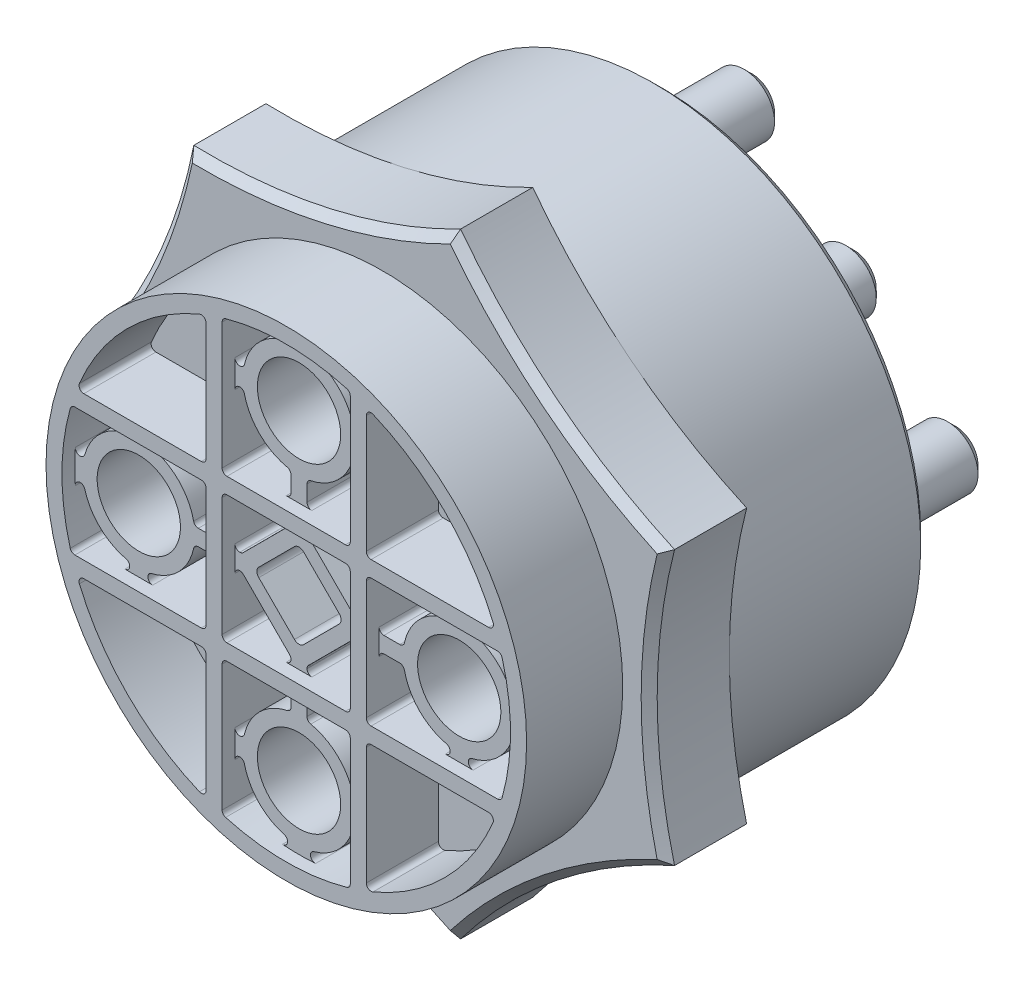
from build123d import *

# Parameters (mm, degrees)
SKETCH1_R                = 16.65
SKETCH1_R_2              = 3.275
SKETCH1_R_3              = 4.1
BOSS_EXTRUDE1_DEPTH      = 2.375
SKETCH2_R                = 16.65
BOSS_EXTRUDE2_DEPTH      = 22.075
CUT_EXTRUDE1_START       = -10
SKETCH3_R                = 16.65
SKETCH3_R_2              = 15
CUT_EXTRUDE1_DEPTH       = 10
CUT_EXTRUDE3_DEPTH       = 4.5
SKETCH6_3_R              = 2.5
CUT_EXTRUDE4_DEPTH       = 0.8
SKETCH6_4_R              = 2.5
CUT_EXTRUDE5_DEPTH       = 9.2
CUT_EXTRUDE6_DEPTH       = 29.053653951
SKETCH8_R                = 3.5
CUT_EXTRUDE7_DEPTH       = 2.8
BOSS_EXTRUDE3_DEPTH      = 4
BOSS_EXTRUDE3_DEPTH_BACK = 2
SKETCH9_R                = 15
SKETCH10_R               = 1.9
BOSS_EXTRUDE4_DEPTH      = 8
CHAMFER1_SIZE            = 0.5
CHAMFER2_SIZE            = 0.5
SKETCH11_R               = 2.5
BOSS_EXTRUDE5_DEPTH      = 0.3
SKETCH12_R               = 2.6
CUT_EXTRUDE8_DEPTH       = 8.1
CUT_EXTRUDE9_DEPTH       = 41.158350746
CUT_EXTRUDE10_DEPTH      = 1
SKETCH15_R               = 3.5
CUT_EXTRUDE11_DEPTH      = 0.1


with BuildPart() as part:
    # Sketch1 → Boss-Extrude1 (new body)
    with BuildSketch(Plane.XY):
        with Locations(Location((0, 0, 0), (0, 0, 180))):
            Circle(SKETCH1_R)
        with Locations(Location((-6.35, 6.35, 0), (0, 0, 180))):
            Circle(SKETCH1_R_2, mode=Mode.SUBTRACT)
        with Locations(Location((-12.7, 0, 0), (0, 0, 180))):
            Circle(SKETCH1_R_2, mode=Mode.SUBTRACT)
        with Locations(Location((-6.35, -6.35, 0), (0, 0, 180))):
            Circle(SKETCH1_R_2, mode=Mode.SUBTRACT)
        with Locations(Location((0, 0, 0), (0, 0, 180))):
            Circle(SKETCH1_R_3, mode=Mode.SUBTRACT)
        with Locations(Location((0, 12.7, 0), (0, 0, 180))):
            Circle(SKETCH1_R_2, mode=Mode.SUBTRACT)
        with Locations(Location((6.35, 6.35, 0), (0, 0, 180))):
            Circle(SKETCH1_R_2, mode=Mode.SUBTRACT)
        with Locations(Location((12.7, 0, 0), (0, 0, 180))):
            Circle(SKETCH1_R_2, mode=Mode.SUBTRACT)
        with Locations(Location((6.35, -6.35, 0), (0, 0, 180))):
            Circle(SKETCH1_R_2, mode=Mode.SUBTRACT)
        with Locations(Location((0, -12.7, 0), (0, 0, 180))):
            Circle(SKETCH1_R_2, mode=Mode.SUBTRACT)
    extrude(amount=BOSS_EXTRUDE1_DEPTH)

    # Sketch2 → Boss-Extrude2 (add)
    with BuildSketch(Plane.XY.offset(2.375)):
        with Locations(Location((0, 0, 0), (0, 0, 180))):
            Circle(SKETCH2_R)
    extrude(amount=BOSS_EXTRUDE2_DEPTH)

    # Sketch3 → Cut-Extrude1 (cut)
    with BuildSketch(Plane.XY.offset(24.45).offset(CUT_EXTRUDE1_START)):
        with Locations(Location((0, 0, 0), (0, 0, 180))):
            Circle(SKETCH3_R)
        Circle(SKETCH3_R_2, mode=Mode.SUBTRACT)
    extrude(amount=CUT_EXTRUDE1_DEPTH, mode=Mode.SUBTRACT)

    # Sketch6 → Cut-Extrude3 (cut)
    with BuildSketch(Plane.XY.offset(24.45)):
        with BuildLine():
            Line((-12.640008247, 5.029016647), (-5.306718889, 5.029016647))
            ThreePointArc((-5.306718889, 5.029016647), (-5.094586855, 5.116884613), (-5.006718889, 5.329016647))
            Line((-5.006718889, 5.329016647), (-5.006718889, 12.662306005))
            ThreePointArc((-5.006718889, 12.662306005), (-5.140612776, 12.912123457), (-5.422777283, 12.938947378))
            ThreePointArc((-5.422777283, 12.938947378), (-9.906213826, 9.928511584), (-12.91664962, 5.445075041))
            ThreePointArc((-12.91664962, 5.445075041), (-12.889825699, 5.162910534), (-12.640008247, 5.029016647))
        make_face()
        with BuildLine():
            ThreePointArc((-5.006718889, 3.729016647), (-5.094586855, 3.941148681), (-5.306718889, 4.029016647))
            Line((-5.306718889, 4.029016647), (-9.140693485, 4.029016647))
            ThreePointArc((-9.140693485, 4.029016647), (-9.438713266, 3.763429007), (-9.209063912, 3.436911384))
            ThreePointArc((-9.209063912, 3.436911384), (-7.509906625, 2.481755629), (-6.585160222, 0.765858752))
            ThreePointArc((-6.585160222, 0.765858752), (-6.480368024, 0.595620665), (-6.291883765, 0.529016647))
            Line((-6.291883765, 0.529016647), (-5.306718889, 0.529016647))
            ThreePointArc((-5.306718889, 0.529016647), (-5.094586855, 0.616884613), (-5.006718889, 0.829016647))
            Line((-5.006718889, 0.829016647), (-5.006718889, 3.729016647))
        make_face()
        with BuildLine():
            ThreePointArc((-10.804373866, 3.436911384), (-10.574724512, 3.763429007), (-10.872744293, 4.029016647))
            Line((-10.872744293, 4.029016647), (-13.197624847, 4.029016647))
            ThreePointArc((-13.197624847, 4.029016647), (-13.378861475, 3.968084179), (-13.486476803, 3.810038545))
            ThreePointArc((-13.486476803, 3.810038545), (-13.795956479, 2.449125466), (-13.968397721, 1.064161173))
            ThreePointArc((-13.968397721, 1.064161173), (-13.720540912, 0.746402019), (-13.380074152, 0.962008752))
            ThreePointArc((-13.380074152, 0.962008752), (-12.431717315, 2.552780232), (-10.804373866, 3.436911384))
        make_face()
        with BuildLine():
            ThreePointArc((-13.380074152, -0.903975458), (-13.720540912, -0.688368725), (-13.968397721, -1.006127879))
            ThreePointArc((-13.968397721, -1.006127879), (-13.795956479, -2.391092172), (-13.486476803, -3.752005251))
            ThreePointArc((-13.486476803, -3.752005251), (-13.378861475, -3.910050885), (-13.197624847, -3.970983353))
            Line((-13.197624847, -3.970983353), (-10.872744293, -3.970983353))
            ThreePointArc((-10.872744293, -3.970983353), (-10.574724512, -3.705395713), (-10.804373866, -3.37887809))
            ThreePointArc((-10.804373866, -3.37887809), (-12.431717315, -2.494746938), (-13.380074152, -0.903975458))
        make_face()
        with BuildLine():
            Line((-5.006718889, -3.670983353), (-5.006718889, -0.770983353))
            ThreePointArc((-5.006718889, -0.770983353), (-5.094586855, -0.558851319), (-5.306718889, -0.470983353))
            Line((-5.306718889, -0.470983353), (-6.291883765, -0.470983353))
            ThreePointArc((-6.291883765, -0.470983353), (-6.480368024, -0.537587371), (-6.585160222, -0.707825458))
            ThreePointArc((-6.585160222, -0.707825458), (-7.509906625, -2.423722335), (-9.209063912, -3.37887809))
            ThreePointArc((-9.209063912, -3.37887809), (-9.438713266, -3.705395713), (-9.140693485, -3.970983353))
            Line((-9.140693485, -3.970983353), (-5.306718889, -3.970983353))
            ThreePointArc((-5.306718889, -3.970983353), (-5.094586855, -3.883115387), (-5.006718889, -3.670983353))
        make_face()
        with BuildLine():
            Line((-5.006718889, -12.604272711), (-5.006718889, -5.270983353))
            ThreePointArc((-5.006718889, -5.270983353), (-5.094586855, -5.058851319), (-5.306718889, -4.970983353))
            Line((-5.306718889, -4.970983353), (-12.640008247, -4.970983353))
            ThreePointArc((-12.640008247, -4.970983353), (-12.889825699, -5.10487724), (-12.91664962, -5.387041747))
            ThreePointArc((-12.91664962, -5.387041747), (-9.906213826, -9.87047829), (-5.422777283, -12.880914084))
            ThreePointArc((-5.422777283, -12.880914084), (-5.140612776, -12.854090162), (-5.006718889, -12.604272711))
        make_face()
        with BuildLine():
            ThreePointArc((-3.706718889, -4.970983353), (-3.918850923, -5.058851319), (-4.006718889, -5.270983353))
            Line((-4.006718889, -5.270983353), (-4.006718889, -9.104957949))
            ThreePointArc((-4.006718889, -9.104957949), (-3.741131249, -9.40297773), (-3.414613626, -9.173328376))
            ThreePointArc((-3.414613626, -9.173328376), (-2.459457871, -7.474171088), (-0.743560994, -6.549424686))
            ThreePointArc((-0.743560994, -6.549424686), (-0.573322907, -6.444632487), (-0.506718889, -6.256148229))
            Line((-0.506718889, -6.256148229), (-0.506718889, -5.270983353))
            ThreePointArc((-0.506718889, -5.270983353), (-0.594586855, -5.058851319), (-0.806718889, -4.970983353))
            Line((-0.806718889, -4.970983353), (-3.706718889, -4.970983353))
        make_face()
        with BuildLine():
            Line((3.693281111, -4.970983353), (0.793281111, -4.970983353))
            ThreePointArc((0.793281111, -4.970983353), (0.581149077, -5.058851319), (0.493281111, -5.270983353))
            Line((0.493281111, -5.270983353), (0.493281111, -6.256148229))
            ThreePointArc((0.493281111, -6.256148229), (0.559885129, -6.444632487), (0.730123216, -6.549424686))
            ThreePointArc((0.730123216, -6.549424686), (2.446020093, -7.474171088), (3.401175848, -9.173328376))
            ThreePointArc((3.401175848, -9.173328376), (3.727693471, -9.40297773), (3.993281111, -9.104957949))
            Line((3.993281111, -9.104957949), (3.993281111, -5.270983353))
            ThreePointArc((3.993281111, -5.270983353), (3.905413145, -5.058851319), (3.693281111, -4.970983353))
        make_face()
        with BuildLine():
            ThreePointArc((0.926273216, -13.344338616), (0.710666483, -13.684805376), (1.028425637, -13.932662185))
            ThreePointArc((1.028425637, -13.932662185), (2.41338993, -13.760220943), (3.774303009, -13.450741267))
            ThreePointArc((3.774303009, -13.450741267), (3.932348643, -13.343125939), (3.993281111, -13.161889311))
            Line((3.993281111, -13.161889311), (3.993281111, -10.837008757))
            ThreePointArc((3.993281111, -10.837008757), (3.727693471, -10.538988976), (3.401175848, -10.76863833))
            ThreePointArc((3.401175848, -10.76863833), (2.517044696, -12.395981779), (0.926273216, -13.344338616))
        make_face()
        with BuildLine():
            ThreePointArc((-3.414613626, -10.76863833), (-3.741131249, -10.538988976), (-4.006718889, -10.837008757))
            Line((-4.006718889, -10.837008757), (-4.006718889, -13.161889311))
            ThreePointArc((-4.006718889, -13.161889311), (-3.945786421, -13.343125939), (-3.787740787, -13.450741267))
            ThreePointArc((-3.787740787, -13.450741267), (-2.426827708, -13.760220943), (-1.041863415, -13.932662185))
            ThreePointArc((-1.041863415, -13.932662185), (-0.724104261, -13.684805376), (-0.939710994, -13.344338616))
            ThreePointArc((-0.939710994, -13.344338616), (-2.530482474, -12.395981779), (-3.414613626, -10.76863833))
        make_face()
        with BuildLine():
            Line((12.626570469, -4.970983353), (5.293281111, -4.970983353))
            ThreePointArc((5.293281111, -4.970983353), (5.081149077, -5.058851319), (4.993281111, -5.270983353))
            Line((4.993281111, -5.270983353), (4.993281111, -12.604272711))
            ThreePointArc((4.993281111, -12.604272711), (5.127174998, -12.854090162), (5.409339505, -12.880914084))
            ThreePointArc((5.409339505, -12.880914084), (9.892776048, -9.87047829), (12.903211842, -5.387041747))
            ThreePointArc((12.903211842, -5.387041747), (12.87638792, -5.10487724), (12.626570469, -4.970983353))
        make_face()
        with BuildLine():
            ThreePointArc((4.993281111, -3.670983353), (5.081149077, -3.883115387), (5.293281111, -3.970983353))
            Line((5.293281111, -3.970983353), (9.127255707, -3.970983353))
            ThreePointArc((9.127255707, -3.970983353), (9.425275488, -3.705395713), (9.195626134, -3.37887809))
            ThreePointArc((9.195626134, -3.37887809), (7.496468846, -2.423722335), (6.571722444, -0.707825458))
            ThreePointArc((6.571722444, -0.707825458), (6.466930245, -0.537587371), (6.278445987, -0.470983353))
            Line((6.278445987, -0.470983353), (5.293281111, -0.470983353))
            ThreePointArc((5.293281111, -0.470983353), (5.081149077, -0.558851319), (4.993281111, -0.770983353))
            Line((4.993281111, -0.770983353), (4.993281111, -3.670983353))
        make_face()
        with BuildLine():
            Line((4.993281111, 3.729016647), (4.993281111, 0.829016647))
            ThreePointArc((4.993281111, 0.829016647), (5.081149077, 0.616884613), (5.293281111, 0.529016647))
            Line((5.293281111, 0.529016647), (6.278445987, 0.529016647))
            ThreePointArc((6.278445987, 0.529016647), (6.466930245, 0.595620665), (6.571722444, 0.765858752))
            ThreePointArc((6.571722444, 0.765858752), (7.496468846, 2.481755629), (9.195626134, 3.436911384))
            ThreePointArc((9.195626134, 3.436911384), (9.425275488, 3.763429007), (9.127255707, 4.029016647))
            Line((9.127255707, 4.029016647), (5.293281111, 4.029016647))
            ThreePointArc((5.293281111, 4.029016647), (5.081149077, 3.941148681), (4.993281111, 3.729016647))
        make_face()
        with BuildLine():
            Line((4.993281111, 12.662306005), (4.993281111, 5.329016647))
            ThreePointArc((4.993281111, 5.329016647), (5.081149077, 5.116884613), (5.293281111, 5.029016647))
            Line((5.293281111, 5.029016647), (12.626570469, 5.029016647))
            ThreePointArc((12.626570469, 5.029016647), (12.87638792, 5.162910534), (12.903211842, 5.445075041))
            ThreePointArc((12.903211842, 5.445075041), (9.892776048, 9.928511584), (5.409339505, 12.938947378))
            ThreePointArc((5.409339505, 12.938947378), (5.127174998, 12.912123457), (4.993281111, 12.662306005))
        make_face()
        with BuildLine():
            ThreePointArc((3.693281111, 5.029016647), (3.905413145, 5.116884613), (3.993281111, 5.329016647))
            Line((3.993281111, 5.329016647), (3.993281111, 9.162991243))
            ThreePointArc((3.993281111, 9.162991243), (3.727693471, 9.461011024), (3.401175848, 9.23136167))
            ThreePointArc((3.401175848, 9.23136167), (2.446020093, 7.532204383), (0.730123216, 6.60745798))
            ThreePointArc((0.730123216, 6.60745798), (0.559885129, 6.502665782), (0.493281111, 6.314181523))
            Line((0.493281111, 6.314181523), (0.493281111, 5.329016647))
            ThreePointArc((0.493281111, 5.329016647), (0.581149077, 5.116884613), (0.793281111, 5.029016647))
            Line((0.793281111, 5.029016647), (3.693281111, 5.029016647))
        make_face()
        with BuildLine():
            Line((-3.706718889, 5.029016647), (-0.806718889, 5.029016647))
            ThreePointArc((-0.806718889, 5.029016647), (-0.594586855, 5.116884613), (-0.506718889, 5.329016647))
            Line((-0.506718889, 5.329016647), (-0.506718889, 6.314181523))
            ThreePointArc((-0.506718889, 6.314181523), (-0.573322907, 6.502665782), (-0.743560994, 6.60745798))
            ThreePointArc((-0.743560994, 6.60745798), (-2.459457871, 7.532204383), (-3.414613626, 9.23136167))
            ThreePointArc((-3.414613626, 9.23136167), (-3.741131249, 9.461011024), (-4.006718889, 9.162991243))
            Line((-4.006718889, 9.162991243), (-4.006718889, 5.329016647))
            ThreePointArc((-4.006718889, 5.329016647), (-3.918850923, 5.116884613), (-3.706718889, 5.029016647))
        make_face()
        with BuildLine():
            ThreePointArc((-0.939710994, 13.40237191), (-0.724104261, 13.74283867), (-1.041863415, 13.990695479))
            ThreePointArc((-1.041863415, 13.990695479), (-2.426827708, 13.818254237), (-3.787740787, 13.508774561))
            ThreePointArc((-3.787740787, 13.508774561), (-3.945786421, 13.401159233), (-4.006718889, 13.219922605))
            Line((-4.006718889, 13.219922605), (-4.006718889, 10.895042051))
            ThreePointArc((-4.006718889, 10.895042051), (-3.741131249, 10.59702227), (-3.414613626, 10.826671624))
            ThreePointArc((-3.414613626, 10.826671624), (-2.530482474, 12.454015073), (-0.939710994, 13.40237191))
        make_face()
        with BuildLine():
            ThreePointArc((3.401175848, 10.826671624), (3.727693471, 10.59702227), (3.993281111, 10.895042051))
            Line((3.993281111, 10.895042051), (3.993281111, 13.219922605))
            ThreePointArc((3.993281111, 13.219922605), (3.932348643, 13.401159233), (3.774303009, 13.508774561))
            ThreePointArc((3.774303009, 13.508774561), (2.41338993, 13.818254237), (1.028425637, 13.990695479))
            ThreePointArc((1.028425637, 13.990695479), (0.710666483, 13.74283867), (0.926273216, 13.40237191))
            ThreePointArc((0.926273216, 13.40237191), (2.517044696, 12.454015073), (3.401175848, 10.826671624))
        make_face()
        with BuildLine():
            ThreePointArc((-0.506718889, 3.729016647), (-0.594586855, 3.941148681), (-0.806718889, 4.029016647))
            Line((-0.806718889, 4.029016647), (-3.706718889, 4.029016647))
            ThreePointArc((-3.706718889, 4.029016647), (-3.918850923, 3.941148681), (-4.006718889, 3.729016647))
            Line((-4.006718889, 3.729016647), (-4.006718889, 0.829016647))
            ThreePointArc((-4.006718889, 0.829016647), (-3.918850923, 0.616884613), (-3.706718889, 0.529016647))
            Line((-3.706718889, 0.529016647), (-3.69684695, 0.529016647))
            ThreePointArc((-3.69684695, 0.529016647), (-3.58204192, 0.551852787), (-3.484714915, 0.616884613))
            Line((-3.484714915, 0.616884613), (-0.594586855, 3.507012673))
            ThreePointArc((-0.594586855, 3.507012673), (-0.529555029, 3.604339678), (-0.506718889, 3.719144708))
            Line((-0.506718889, 3.719144708), (-0.506718889, 3.729016647))
        make_face()
        with BuildLine():
            Line((-3.706718889, -3.970983353), (-0.806718889, -3.970983353))
            ThreePointArc((-0.806718889, -3.970983353), (-0.594586855, -3.883115387), (-0.506718889, -3.670983353))
            Line((-0.506718889, -3.670983353), (-0.506718889, -3.661111414))
            ThreePointArc((-0.506718889, -3.661111414), (-0.529555029, -3.546306384), (-0.594586855, -3.448979379))
            Line((-0.594586855, -3.448979379), (-3.484714915, -0.558851319))
            ThreePointArc((-3.484714915, -0.558851319), (-3.58204192, -0.493819493), (-3.69684695, -0.470983353))
            Line((-3.69684695, -0.470983353), (-3.706718889, -0.470983353))
            ThreePointArc((-3.706718889, -0.470983353), (-3.918850923, -0.558851319), (-4.006718889, -0.770983353))
            Line((-4.006718889, -0.770983353), (-4.006718889, -3.670983353))
            ThreePointArc((-4.006718889, -3.670983353), (-3.918850923, -3.883115387), (-3.706718889, -3.970983353))
        make_face()
        with BuildLine():
            ThreePointArc((3.693281111, -3.970983353), (3.905413145, -3.883115387), (3.993281111, -3.670983353))
            Line((3.993281111, -3.670983353), (3.993281111, -0.770983353))
            ThreePointArc((3.993281111, -0.770983353), (3.905413145, -0.558851319), (3.693281111, -0.470983353))
            Line((3.693281111, -0.470983353), (3.683409171, -0.470983353))
            ThreePointArc((3.683409171, -0.470983353), (3.568604142, -0.493819493), (3.471277137, -0.558851319))
            Line((3.471277137, -0.558851319), (0.581149077, -3.448979379))
            ThreePointArc((0.581149077, -3.448979379), (0.516117251, -3.546306384), (0.493281111, -3.661111414))
            Line((0.493281111, -3.661111414), (0.493281111, -3.670983353))
            ThreePointArc((0.493281111, -3.670983353), (0.581149077, -3.883115387), (0.793281111, -3.970983353))
            Line((0.793281111, -3.970983353), (3.693281111, -3.970983353))
        make_face()
        with BuildLine():
            ThreePointArc((3.693281111, 0.529016647), (3.905413145, 0.616884613), (3.993281111, 0.829016647))
            Line((3.993281111, 0.829016647), (3.993281111, 3.729016647))
            ThreePointArc((3.993281111, 3.729016647), (3.905413145, 3.941148681), (3.693281111, 4.029016647))
            Line((3.693281111, 4.029016647), (0.793281111, 4.029016647))
            ThreePointArc((0.793281111, 4.029016647), (0.581149077, 3.941148681), (0.493281111, 3.729016647))
            Line((0.493281111, 3.729016647), (0.493281111, 3.719144708))
            ThreePointArc((0.493281111, 3.719144708), (0.516117251, 3.604339678), (0.581149077, 3.507012673))
            Line((0.581149077, 3.507012673), (3.471277137, 0.616884613))
            ThreePointArc((3.471277137, 0.616884613), (3.568604142, 0.551852787), (3.683409171, 0.529016647))
            Line((3.683409171, 0.529016647), (3.693281111, 0.529016647))
        make_face()
        with BuildLine():
            ThreePointArc((13.366636374, 0.962008752), (13.707103134, 0.746402019), (13.954959943, 1.064161173))
            ThreePointArc((13.954959943, 1.064161173), (13.782518701, 2.449125466), (13.473039025, 3.810038545))
            ThreePointArc((13.473039025, 3.810038545), (13.365423697, 3.968084179), (13.184187069, 4.029016647))
            Line((13.184187069, 4.029016647), (10.859306515, 4.029016647))
            ThreePointArc((10.859306515, 4.029016647), (10.561286734, 3.763429007), (10.790936088, 3.436911384))
            ThreePointArc((10.790936088, 3.436911384), (12.418279537, 2.552780232), (13.366636374, 0.962008752))
        make_face()
        with BuildLine():
            ThreePointArc((10.790936088, -3.37887809), (10.561286734, -3.705395713), (10.859306515, -3.970983353))
            Line((10.859306515, -3.970983353), (13.184187069, -3.970983353))
            ThreePointArc((13.184187069, -3.970983353), (13.365423697, -3.910050885), (13.473039025, -3.752005251))
            ThreePointArc((13.473039025, -3.752005251), (13.782518701, -2.391092172), (13.954959943, -1.006127879))
            ThreePointArc((13.954959943, -1.006127879), (13.707103134, -0.688368725), (13.366636374, -0.903975458))
            ThreePointArc((13.366636374, -0.903975458), (12.418279537, -2.494746938), (10.790936088, -3.37887809))
        make_face()
    extrude(amount=-CUT_EXTRUDE3_DEPTH, mode=Mode.SUBTRACT)

    # Sketch6<3> → Cut-Extrude4 (cut)
    # profile 1 of 5: a face of its own
    with BuildSketch(Plane.XY.offset(24.45)):
        with BuildLine():
            ThreePointArc((3.401175848, 9.23136167), (3.727693471, 9.461011024), (3.993281111, 9.162991243))
            Line((3.993281111, 9.162991243), (3.993281111, 10.895042051))
            ThreePointArc((3.993281111, 10.895042051), (3.727693471, 10.59702227), (3.401175848, 10.826671624))
            ThreePointArc((3.401175848, 10.826671624), (2.517044696, 12.454015073), (0.926273216, 13.40237191))
            ThreePointArc((0.926273216, 13.40237191), (0.710666483, 13.74283867), (1.028425637, 13.990695479))
            ThreePointArc((1.028425637, 13.990695479), (-0.006718889, 14.029016647), (-1.041863415, 13.990695479))
            ThreePointArc((-1.041863415, 13.990695479), (-0.724104261, 13.74283867), (-0.939710994, 13.40237191))
            ThreePointArc((-0.939710994, 13.40237191), (-2.530482474, 12.454015073), (-3.414613626, 10.826671624))
            ThreePointArc((-3.414613626, 10.826671624), (-3.741131249, 10.59702227), (-4.006718889, 10.895042051))
            Line((-4.006718889, 10.895042051), (-4.006718889, 9.162991243))
            ThreePointArc((-4.006718889, 9.162991243), (-3.741131249, 9.461011024), (-3.414613626, 9.23136167))
            ThreePointArc((-3.414613626, 9.23136167), (-2.459457871, 7.532204383), (-0.743560994, 6.60745798))
            ThreePointArc((-0.743560994, 6.60745798), (-0.573322907, 6.502665782), (-0.506718889, 6.314181523))
            Line((-0.506718889, 6.314181523), (-0.506718889, 5.329016647))
            ThreePointArc((-0.506718889, 5.329016647), (-0.594586855, 5.116884613), (-0.806718889, 5.029016647))
            Line((-0.806718889, 5.029016647), (0.793281111, 5.029016647))
            ThreePointArc((0.793281111, 5.029016647), (0.581149077, 5.116884613), (0.493281111, 5.329016647))
            Line((0.493281111, 5.329016647), (0.493281111, 6.314181523))
            ThreePointArc((0.493281111, 6.314181523), (0.559885129, 6.502665782), (0.730123216, 6.60745798))
            ThreePointArc((0.730123216, 6.60745798), (2.446020093, 7.532204383), (3.401175848, 9.23136167))
        make_face()
        with Locations((-0.006718889, 10.029016647)):
            Circle(SKETCH6_3_R, mode=Mode.SUBTRACT)
    # profile 2 of 5: a face of its own
    with BuildSketch(Plane.XY.offset(24.45)):
        with BuildLine():
            ThreePointArc((3.693281111, -0.470983353), (3.905413145, -0.558851319), (3.993281111, -0.770983353))
            Line((3.993281111, -0.770983353), (3.993281111, 0.829016647))
            ThreePointArc((3.993281111, 0.829016647), (3.905413145, 0.616884613), (3.693281111, 0.529016647))
            Line((3.693281111, 0.529016647), (3.683409171, 0.529016647))
            ThreePointArc((3.683409171, 0.529016647), (3.568604142, 0.551852787), (3.471277137, 0.616884613))
            Line((3.471277137, 0.616884613), (0.581149077, 3.507012673))
            ThreePointArc((0.581149077, 3.507012673), (0.516117251, 3.604339678), (0.493281111, 3.719144708))
            Line((0.493281111, 3.719144708), (0.493281111, 3.729016647))
            ThreePointArc((0.493281111, 3.729016647), (0.581149077, 3.941148681), (0.793281111, 4.029016647))
            Line((0.793281111, 4.029016647), (-0.806718889, 4.029016647))
            ThreePointArc((-0.806718889, 4.029016647), (-0.594586855, 3.941148681), (-0.506718889, 3.729016647))
            Line((-0.506718889, 3.729016647), (-0.506718889, 3.719144708))
            ThreePointArc((-0.506718889, 3.719144708), (-0.529555029, 3.604339678), (-0.594586855, 3.507012673))
            Line((-0.594586855, 3.507012673), (-3.484714915, 0.616884613))
            ThreePointArc((-3.484714915, 0.616884613), (-3.58204192, 0.551852787), (-3.69684695, 0.529016647))
            Line((-3.69684695, 0.529016647), (-3.706718889, 0.529016647))
            ThreePointArc((-3.706718889, 0.529016647), (-3.918850923, 0.616884613), (-4.006718889, 0.829016647))
            Line((-4.006718889, 0.829016647), (-4.006718889, -0.770983353))
            ThreePointArc((-4.006718889, -0.770983353), (-3.918850923, -0.558851319), (-3.706718889, -0.470983353))
            Line((-3.706718889, -0.470983353), (-3.69684695, -0.470983353))
            ThreePointArc((-3.69684695, -0.470983353), (-3.58204192, -0.493819493), (-3.484714915, -0.558851319))
            Line((-3.484714915, -0.558851319), (-0.594586855, -3.448979379))
            ThreePointArc((-0.594586855, -3.448979379), (-0.529555029, -3.546306384), (-0.506718889, -3.661111414))
            Line((-0.506718889, -3.661111414), (-0.506718889, -3.670983353))
            ThreePointArc((-0.506718889, -3.670983353), (-0.594586855, -3.883115387), (-0.806718889, -3.970983353))
            Line((-0.806718889, -3.970983353), (0.793281111, -3.970983353))
            ThreePointArc((0.793281111, -3.970983353), (0.581149077, -3.883115387), (0.493281111, -3.670983353))
            Line((0.493281111, -3.670983353), (0.493281111, -3.661111414))
            ThreePointArc((0.493281111, -3.661111414), (0.516117251, -3.546306384), (0.581149077, -3.448979379))
            Line((0.581149077, -3.448979379), (3.471277137, -0.558851319))
            ThreePointArc((3.471277137, -0.558851319), (3.568604142, -0.493819493), (3.683409171, -0.470983353))
            Line((3.683409171, -0.470983353), (3.693281111, -0.470983353))
        make_face()
        with BuildLine():
            Line((-2.446237284, 0.241148681), (-0.218850923, 2.468535042))
            ThreePointArc((-0.218850923, 2.468535042), (-0.006718889, 2.556403008), (0.205413145, 2.468535042))
            Line((0.205413145, 2.468535042), (2.432799506, 0.241148681))
            ThreePointArc((2.432799506, 0.241148681), (2.520667472, 0.029016647), (2.432799506, -0.183115387))
            Line((2.432799506, -0.183115387), (0.205413145, -2.410501748))
            ThreePointArc((0.205413145, -2.410501748), (-0.006718889, -2.498369714), (-0.218850923, -2.410501748))
            Line((-0.218850923, -2.410501748), (-2.446237284, -0.183115387))
            ThreePointArc((-2.446237284, -0.183115387), (-2.53410525, 0.029016647), (-2.446237284, 0.241148681))
        make_face(mode=Mode.SUBTRACT)
    # profile 3 of 5: a face of its own
    with BuildSketch(Plane.XY.offset(24.45)):
        with BuildLine():
            ThreePointArc((9.195626134, -3.37887809), (9.425275488, -3.705395713), (9.127255707, -3.970983353))
            Line((9.127255707, -3.970983353), (10.859306515, -3.970983353))
            ThreePointArc((10.859306515, -3.970983353), (10.561286734, -3.705395713), (10.790936088, -3.37887809))
            ThreePointArc((10.790936088, -3.37887809), (12.418279537, -2.494746938), (13.366636374, -0.903975458))
            ThreePointArc((13.366636374, -0.903975458), (13.707103134, -0.688368725), (13.954959943, -1.006127879))
            ThreePointArc((13.954959943, -1.006127879), (13.993281111, 0.029016647), (13.954959943, 1.064161173))
            ThreePointArc((13.954959943, 1.064161173), (13.707103134, 0.746402019), (13.366636374, 0.962008752))
            ThreePointArc((13.366636374, 0.962008752), (12.418279537, 2.552780232), (10.790936088, 3.436911384))
            ThreePointArc((10.790936088, 3.436911384), (10.561286734, 3.763429007), (10.859306515, 4.029016647))
            Line((10.859306515, 4.029016647), (9.127255707, 4.029016647))
            ThreePointArc((9.127255707, 4.029016647), (9.425275488, 3.763429007), (9.195626134, 3.436911384))
            ThreePointArc((9.195626134, 3.436911384), (7.496468846, 2.481755629), (6.571722444, 0.765858752))
            ThreePointArc((6.571722444, 0.765858752), (6.466930245, 0.595620665), (6.278445987, 0.529016647))
            Line((6.278445987, 0.529016647), (5.293281111, 0.529016647))
            ThreePointArc((5.293281111, 0.529016647), (5.081149077, 0.616884613), (4.993281111, 0.829016647))
            Line((4.993281111, 0.829016647), (4.993281111, -0.770983353))
            ThreePointArc((4.993281111, -0.770983353), (5.081149077, -0.558851319), (5.293281111, -0.470983353))
            Line((5.293281111, -0.470983353), (6.278445987, -0.470983353))
            ThreePointArc((6.278445987, -0.470983353), (6.466930245, -0.537587371), (6.571722444, -0.707825458))
            ThreePointArc((6.571722444, -0.707825458), (7.496468846, -2.423722335), (9.195626134, -3.37887809))
        make_face()
        with Locations((9.993281111, 0.029016647)):
            Circle(SKETCH6_3_R, mode=Mode.SUBTRACT)
    # profile 4 of 5: a face of its own
    with BuildSketch(Plane.XY.offset(24.45)):
        with BuildLine():
            ThreePointArc((-3.414613626, -9.173328376), (-3.741131249, -9.40297773), (-4.006718889, -9.104957949))
            Line((-4.006718889, -9.104957949), (-4.006718889, -10.837008757))
            ThreePointArc((-4.006718889, -10.837008757), (-3.741131249, -10.538988976), (-3.414613626, -10.76863833))
            ThreePointArc((-3.414613626, -10.76863833), (-2.530482474, -12.395981779), (-0.939710994, -13.344338616))
            ThreePointArc((-0.939710994, -13.344338616), (-0.724104261, -13.684805376), (-1.041863415, -13.932662185))
            ThreePointArc((-1.041863415, -13.932662185), (-0.006718889, -13.970983353), (1.028425637, -13.932662185))
            ThreePointArc((1.028425637, -13.932662185), (0.710666483, -13.684805376), (0.926273216, -13.344338616))
            ThreePointArc((0.926273216, -13.344338616), (2.517044696, -12.395981779), (3.401175848, -10.76863833))
            ThreePointArc((3.401175848, -10.76863833), (3.727693471, -10.538988976), (3.993281111, -10.837008757))
            Line((3.993281111, -10.837008757), (3.993281111, -9.104957949))
            ThreePointArc((3.993281111, -9.104957949), (3.727693471, -9.40297773), (3.401175848, -9.173328376))
            ThreePointArc((3.401175848, -9.173328376), (2.446020093, -7.474171088), (0.730123216, -6.549424686))
            ThreePointArc((0.730123216, -6.549424686), (0.559885129, -6.444632487), (0.493281111, -6.256148229))
            Line((0.493281111, -6.256148229), (0.493281111, -5.270983353))
            ThreePointArc((0.493281111, -5.270983353), (0.581149077, -5.058851319), (0.793281111, -4.970983353))
            Line((0.793281111, -4.970983353), (-0.806718889, -4.970983353))
            ThreePointArc((-0.806718889, -4.970983353), (-0.594586855, -5.058851319), (-0.506718889, -5.270983353))
            Line((-0.506718889, -5.270983353), (-0.506718889, -6.256148229))
            ThreePointArc((-0.506718889, -6.256148229), (-0.573322907, -6.444632487), (-0.743560994, -6.549424686))
            ThreePointArc((-0.743560994, -6.549424686), (-2.459457871, -7.474171088), (-3.414613626, -9.173328376))
        make_face()
        with Locations((-0.006718889, -9.970983353)):
            Circle(SKETCH6_3_R, mode=Mode.SUBTRACT)
    # profile 5 of 5: a face of its own
    with BuildSketch(Plane.XY.offset(24.45)):
        with BuildLine():
            ThreePointArc((-9.209063912, 3.436911384), (-9.438713266, 3.763429007), (-9.140693485, 4.029016647))
            Line((-9.140693485, 4.029016647), (-10.872744293, 4.029016647))
            ThreePointArc((-10.872744293, 4.029016647), (-10.574724512, 3.763429007), (-10.804373866, 3.436911384))
            ThreePointArc((-10.804373866, 3.436911384), (-12.431717315, 2.552780232), (-13.380074152, 0.962008752))
            ThreePointArc((-13.380074152, 0.962008752), (-13.720540912, 0.746402019), (-13.968397721, 1.064161173))
            ThreePointArc((-13.968397721, 1.064161173), (-14.006718889, 0.029016647), (-13.968397721, -1.006127879))
            ThreePointArc((-13.968397721, -1.006127879), (-13.720540912, -0.688368725), (-13.380074152, -0.903975458))
            ThreePointArc((-13.380074152, -0.903975458), (-12.431717315, -2.494746938), (-10.804373866, -3.37887809))
            ThreePointArc((-10.804373866, -3.37887809), (-10.574724512, -3.705395713), (-10.872744293, -3.970983353))
            Line((-10.872744293, -3.970983353), (-9.140693485, -3.970983353))
            ThreePointArc((-9.140693485, -3.970983353), (-9.438713266, -3.705395713), (-9.209063912, -3.37887809))
            ThreePointArc((-9.209063912, -3.37887809), (-7.509906625, -2.423722335), (-6.585160222, -0.707825458))
            ThreePointArc((-6.585160222, -0.707825458), (-6.480368024, -0.537587371), (-6.291883765, -0.470983353))
            Line((-6.291883765, -0.470983353), (-5.306718889, -0.470983353))
            ThreePointArc((-5.306718889, -0.470983353), (-5.094586855, -0.558851319), (-5.006718889, -0.770983353))
            Line((-5.006718889, -0.770983353), (-5.006718889, 0.829016647))
            ThreePointArc((-5.006718889, 0.829016647), (-5.094586855, 0.616884613), (-5.306718889, 0.529016647))
            Line((-5.306718889, 0.529016647), (-6.291883765, 0.529016647))
            ThreePointArc((-6.291883765, 0.529016647), (-6.480368024, 0.595620665), (-6.585160222, 0.765858752))
            ThreePointArc((-6.585160222, 0.765858752), (-7.509906625, 2.481755629), (-9.209063912, 3.436911384))
        make_face()
        with Locations((-10.006718889, 0.029016647)):
            Circle(SKETCH6_3_R, mode=Mode.SUBTRACT)
    extrude(amount=-CUT_EXTRUDE4_DEPTH, mode=Mode.SUBTRACT)

    # Sketch6<4> → Cut-Extrude5 (cut)
    with BuildSketch(Plane.XY.offset(24.45)):
        with Locations((-0.006718889, 10.029016647)):
            Circle(SKETCH6_4_R)
        with Locations((9.993281111, 0.029016647)):
            Circle(SKETCH6_4_R)
        with BuildLine():
            Line((-0.218850923, 2.468535042), (-2.446237284, 0.241148681))
            ThreePointArc((-2.446237284, 0.241148681), (-2.53410525, 0.029016647), (-2.446237284, -0.183115387))
            Line((-2.446237284, -0.183115387), (-0.218850923, -2.410501748))
            ThreePointArc((-0.218850923, -2.410501748), (-0.006718889, -2.498369714), (0.205413145, -2.410501748))
            Line((0.205413145, -2.410501748), (2.432799506, -0.183115387))
            ThreePointArc((2.432799506, -0.183115387), (2.520667472, 0.029016647), (2.432799506, 0.241148681))
            Line((2.432799506, 0.241148681), (0.205413145, 2.468535042))
            ThreePointArc((0.205413145, 2.468535042), (-0.006718889, 2.556403008), (-0.218850923, 2.468535042))
        make_face()
        with Locations((-10.006718889, 0.029016647)):
            Circle(SKETCH6_4_R)
        with Locations((-0.006718889, -9.970983353)):
            Circle(SKETCH6_4_R)
    extrude(amount=-CUT_EXTRUDE5_DEPTH, mode=Mode.SUBTRACT)

    # Sketch7 → Cut-Extrude6 (cut, through all)
    with BuildSketch(Plane.XY.offset(15.25)):
        with BuildLine():
            Line((-0.218850923, 2.468535042), (-2.446237284, 0.241148681))
            ThreePointArc((-2.446237284, 0.241148681), (-2.53410525, 0.029016647), (-2.446237284, -0.183115387))
            Line((-2.446237284, -0.183115387), (-0.218850923, -2.410501748))
            ThreePointArc((-0.218850923, -2.410501748), (-0.006718889, -2.498369714), (0.205413145, -2.410501748))
            Line((0.205413145, -2.410501748), (2.432799506, -0.183115387))
            ThreePointArc((2.432799506, -0.183115387), (2.520667472, 0.029016647), (2.432799506, 0.241148681))
            Line((2.432799506, 0.241148681), (0.205413145, 2.468535042))
            ThreePointArc((0.205413145, 2.468535042), (-0.006718889, 2.556403008), (-0.218850923, 2.468535042))
        make_face()
    extrude(amount=-CUT_EXTRUDE6_DEPTH, mode=Mode.SUBTRACT)

    # Sketch8 → Cut-Extrude7 (cut)
    with BuildSketch(Plane.XY.offset(15.25)):
        with Locations((-0.006718889, 10.029016647)):
            Circle(SKETCH8_R)
        with Locations((9.993281111, 0.029016647)):
            Circle(SKETCH8_R)
        with Locations((-0.006718889, -9.970983353)):
            Circle(SKETCH8_R)
        with Locations((-10.006718889, 0.029016647)):
            Circle(SKETCH8_R)
    extrude(amount=-CUT_EXTRUDE7_DEPTH, mode=Mode.SUBTRACT)

    # Sketch9 → Boss-Extrude3 (add, two sides: drawn at the far end of the back side and taken through both)
    with BuildSketch(Plane.XY.offset(14.45).offset(-BOSS_EXTRUDE3_DEPTH_BACK)):
        with BuildLine():
            ThreePointArc((17.734867209, 8.539300112), (16.649999953, -0.001245417), (17.733589534, -8.541953146))
            ThreePointArc((17.733589534, -8.541953146), (10.379806874, -13.018529458), (4.37786585, -19.19060843))
            ThreePointArc((4.37786585, -19.19060843), (-3.240850914, -16.341985419), (-11.3169169, -15.374175322))
            ThreePointArc((-11.3169169, -15.374175322), (-11.79583086, -15.377530645), (-12.274650794, -15.387595953))
            ThreePointArc((-12.274650794, -15.387595953), (-15.001724655, -7.222932871), (-19.682176143, 0.001472223))
            ThreePointArc((-19.682176143, 0.001472223), (-15.000643939, 7.225177043), (-12.272348678, 15.389432064))
            ThreePointArc((-12.272348678, 15.389432064), (-3.704568819, 16.23264211), (4.38073671, 19.189953288))
            ThreePointArc((4.38073671, 19.189953288), (10.381754326, 13.016976497), (17.734867209, 8.539300112))
        make_face()
        Circle(SKETCH9_R, mode=Mode.SUBTRACT)
    extrude(amount=BOSS_EXTRUDE3_DEPTH + BOSS_EXTRUDE3_DEPTH_BACK)

    # Sketch10 → Boss-Extrude4 (add)
    with BuildSketch(Plane(origin=(0, 0, 2.375), x_dir=(-1, 0, 0), z_dir=(0, 0, -1))):
        with Locations(Location((0, -12.7, 0), (0, 0, 180))):
            Circle(SKETCH10_R)
        with Locations(Location((-6.35, -6.35, 0), (0, 0, 180))):
            Circle(SKETCH10_R)
        with Locations(Location((-12.7, 0, 0), (0, 0, 180))):
            Circle(SKETCH10_R)
        with Locations(Location((-6.35, 6.35, 0), (0, 0, 180))):
            Circle(SKETCH10_R)
        with Locations(Location((0, 12.7, 0), (0, 0, 180))):
            Circle(SKETCH10_R)
        with Locations(Location((6.35, 6.35, 0), (0, 0, 180))):
            Circle(SKETCH10_R)
        with Locations(Location((6.35, -6.35, 0), (0, 0, 180))):
            Circle(SKETCH10_R)
        with Locations(Location((12.7, 0, 0), (0, 0, 180))):
            Circle(SKETCH10_R)
    extrude(amount=BOSS_EXTRUDE4_DEPTH)

    # Chamfer1
    chamfer1_edges = [part.edges().sort_by_distance(p)[0] for p in [
        (-1.9, -12.7, -5.625),
        (4.45, -6.35, -5.625),
        (10.8, 0, -5.625),
        (4.45, 6.35, -5.625),
        (-1.9, 12.7, -5.625),
        (-8.25, 6.35, -5.625),
        (-14.6, 0, -5.625),
        (-8.25, -6.35, -5.625),
    ]]
    chamfer(chamfer1_edges, length=CHAMFER1_SIZE)

    # Chamfer2
    chamfer2_edges = [part.edges().sort_by_distance(p)[0] for p in [
        (10.381754326, 13.016976497, 18.45),
        (-3.704568819, 16.23264211, 18.45),
        (-15.000643939, 7.225177043, 18.45),
        (-15.001724655, -7.222932871, 18.45),
        (-3.706997175, -16.232087726, 18.45),
        (10.379806874, -13.018529458, 18.45),
        (16.649999953, -0.001245417, 18.45),
        (16.65, 0, 0),
    ]]
    chamfer(chamfer2_edges, length=CHAMFER2_SIZE)


with BuildPart() as body_2:
    # Split1: the piece on the far side of the plane
    add(part.part)
    split(bisect_by=Plane(origin=(0, 0, 12.45), x_dir=(-1, 0, 0), z_dir=(0, 0, -1)), keep=Keep.BOTTOM)

    # Sketch11 → Boss-Extrude5 (add)
    with BuildSketch(Plane(origin=(0, 0, 15.25), x_dir=(-1, 0, 0), z_dir=(0, 0, -1))):
        with Locations(Location((0.006718889, 10.029016647, 0), (0, 0, 180))):
            Circle(SKETCH11_R)
        with Locations(Location((-9.993281111, 0.029016647, 0), (0, 0, 180))):
            Circle(SKETCH11_R)
        with Locations(Location((0.006718889, -9.970983353, 0), (0, 0, 180))):
            Circle(SKETCH11_R)
        with Locations(Location((10.006718889, 0.029016647, 0), (0, 0, 180))):
            Circle(SKETCH11_R)
    extrude(amount=-BOSS_EXTRUDE5_DEPTH)

    # Sketch12 → Cut-Extrude8 (cut)
    with BuildSketch(Plane.XY.offset(23.65)):
        with Locations((-0.006718889, 10.029016647)):
            Circle(SKETCH12_R)
        with Locations((9.993281111, 0.029016647)):
            Circle(SKETCH12_R)
        with Locations((-0.006718889, -9.970983353)):
            Circle(SKETCH12_R)
        with Locations((-10.006718889, 0.029016647)):
            Circle(SKETCH12_R)
    extrude(amount=-CUT_EXTRUDE8_DEPTH, mode=Mode.SUBTRACT)


with BuildPart() as part_1:
    add(part.part)

    # Split1
    split(bisect_by=Plane(origin=(0, 0, 12.45), x_dir=(-1, 0, 0), z_dir=(0, 0, -1)), keep=Keep.TOP)


with BuildPart() as cut_extrude9_tool:
    # Sketch13 → Cut-Extrude9 (new, through all)
    with BuildSketch(Plane.XY.offset(23.65)):
        with BuildLine():
            Line((-0.289561602, 2.53924572), (-2.516947962, 0.31185936))
            ThreePointArc((-2.516947962, 0.31185936), (-2.63410525, 0.029016647), (-2.516947962, -0.253826065))
            Line((-2.516947962, -0.253826065), (-0.289561602, -2.481212426))
            ThreePointArc((-0.289561602, -2.481212426), (-0.006718889, -2.598369714), (0.276123823, -2.481212426))
            Line((0.276123823, -2.481212426), (2.503510184, -0.253826065))
            ThreePointArc((2.503510184, -0.253826065), (2.620667472, 0.029016647), (2.503510184, 0.31185936))
            Line((2.503510184, 0.31185936), (0.276123823, 2.53924572))
            ThreePointArc((0.276123823, 2.53924572), (-0.006718889, 2.656403008), (-0.289561602, 2.53924572))
        make_face()
    extrude(amount=-CUT_EXTRUDE9_DEPTH)


with BuildPart() as part_2:
    add(part_1.part)

    # Cut-Extrude9: cut by cut_extrude9_tool
    add(cut_extrude9_tool.part, mode=Mode.SUBTRACT)


with BuildPart() as body_2_1:
    add(body_2.part)

    # Cut-Extrude9: cut by cut_extrude9_tool
    add(cut_extrude9_tool.part, mode=Mode.SUBTRACT)

    # Sketch14 → Cut-Extrude10 (cut)
    with BuildSketch(Plane(origin=(0, 0, 12.45), x_dir=(-1, 0, 0), z_dir=(0, 0, -1))):
        with BuildLine():
            ThreePointArc((12.272348678, 15.389432064), (15.000643939, 7.225177043), (19.682176143, 0.001472223))
            ThreePointArc((19.682176143, 0.001472223), (15.001724655, -7.222932871), (12.274650794, -15.387595953))
            ThreePointArc((12.274650794, -15.387595953), (3.706997175, -16.232087726), (-4.37786585, -19.19060843))
            ThreePointArc((-4.37786585, -19.19060843), (-10.379806874, -13.018529458), (-17.733589534, -8.541953146))
            ThreePointArc((-17.733589534, -8.541953146), (-16.649999953, -0.001245417), (-17.734867209, 8.539300112))
            ThreePointArc((-17.734867209, 8.539300112), (-10.381754326, 13.016976497), (-4.38073671, 19.189953288))
            ThreePointArc((-4.38073671, 19.189953288), (3.704568819, 16.23264211), (12.272348678, 15.389432064))
        make_face()
    extrude(amount=-CUT_EXTRUDE10_DEPTH, mode=Mode.SUBTRACT)

    # Sketch15 → Cut-Extrude11 (cut)
    with BuildSketch(Plane(origin=(0, 0, 15.25), x_dir=(-1, 0, 0), z_dir=(0, 0, -1))):
        with Locations((-9.993281111, 0.029016647)):
            Circle(SKETCH15_R)
        with Locations((0.006718889, 10.029016647)):
            Circle(SKETCH15_R)
        with Locations((0.006718889, -9.970983353)):
            Circle(SKETCH15_R)
        with Locations((10.006718889, 0.029016647)):
            Circle(SKETCH15_R)
    extrude(amount=-CUT_EXTRUDE11_DEPTH, mode=Mode.SUBTRACT)


with BuildPart() as body_2_2:
    # Body-Move/Copy1: moved
    add(body_2_1.part.moved(Location((0, 0, -1))))


solid = Compound([part_2.part, body_2_2.part])
